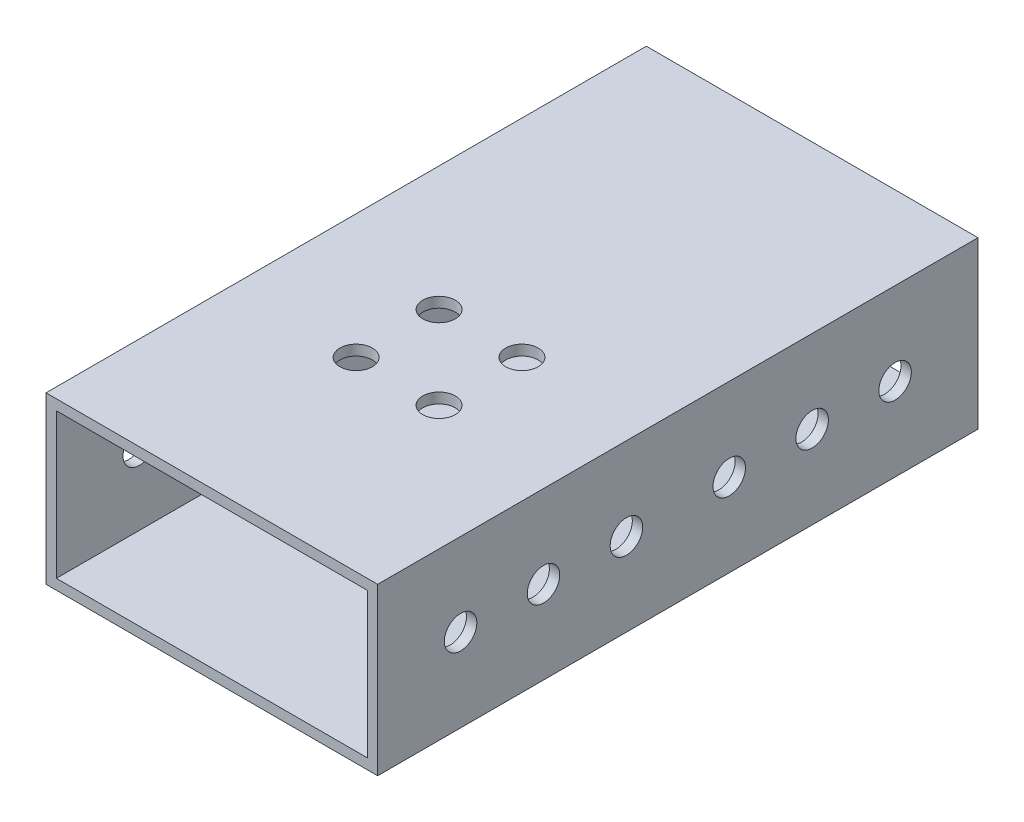
from build123d import *

# Parameters (mm, degrees)
SKETCH1_W           = 50.8
SKETCH1_H           = 25.4
SKETCH1_W_2         = 47.625
SKETCH1_H_2         = 22.225
BOSS_EXTRUDE1_DEPTH = 45.974
SKETCH2_R           = 2.4892
CUT_EXTRUDE1_DEPTH  = 59.343197341
SKETCH3_R           = 2.4892
CUT_EXTRUDE2_DEPTH  = 70.681695416


with BuildPart() as part:
    # Sketch1 → Boss-Extrude1 (new, symmetric)
    with BuildSketch(Plane.XY):
        Rectangle(SKETCH1_W, SKETCH1_H)
        Rectangle(SKETCH1_W_2, SKETCH1_H_2, mode=Mode.SUBTRACT)
    extrude(amount=BOSS_EXTRUDE1_DEPTH, both=True)

    # Sketch2 → Cut-Extrude1 (cut, through all)
    with BuildSketch(Plane(origin=(0, 12.7, 0), x_dir=(1, 0, 0), z_dir=(0, 1, 0))):
        with Locations((-6.35, -4.826)):
            Circle(SKETCH2_R)
        with Locations((6.35, -4.826)):
            Circle(SKETCH2_R)
        with Locations((-6.35, -17.526)):
            Circle(SKETCH2_R)
        with Locations((6.35, -17.526)):
            Circle(SKETCH2_R)
    extrude(amount=-CUT_EXTRUDE1_DEPTH, mode=Mode.SUBTRACT)

    # Sketch3 → Cut-Extrude2 (cut, through all)
    with BuildSketch(Plane(origin=(25.4, 0, 0), x_dir=(0, 0, -1), z_dir=(1, 0, 0))):
        with Locations((33.274, 0)):
            Circle(SKETCH3_R)
        with Locations((20.574, 0)):
            Circle(SKETCH3_R)
        with Locations((7.874, 0)):
            Circle(SKETCH3_R)
        with Locations((-33.274, 0)):
            Circle(SKETCH3_R)
        with Locations((-20.574, 0)):
            Circle(SKETCH3_R)
        with Locations((-7.874, 0)):
            Circle(SKETCH3_R)
    extrude(amount=-CUT_EXTRUDE2_DEPTH, mode=Mode.SUBTRACT)


solid = part.part
